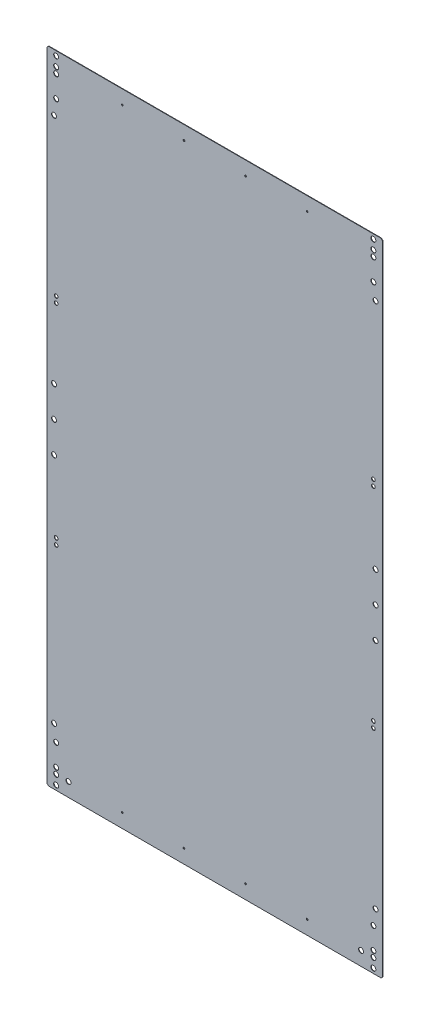
from build123d import *

# Parameters (mm, degrees)
SKETCH_1_W             = 1090
SKETCH_1_H             = 2080
SM_BASE_FLANGE_1_DEPTH = 1.5
SKETCH_6_R             = 8
CUT_EXTRUDE_1_DEPTH    = 10
SKETCH_7_R             = 8
CUT_EXTRUDE_2_DEPTH    = 10
OTHER_START            = -1.5
OTHER_1_DEPTH          = 1.5
SKETCH_11_R            = 6
CUT_EXTRUDE_6_DEPTH    = 10
SKETCH_12_R            = 2.75
CUT_EXTRUDE_7_DEPTH    = 10


# Read off the part's stored shape, not the designer's step: Затупленный угол1
# Sheet-metal steps are written as plain solids
with BuildPart() as part:
    # Sketch 1 → Базовая кромка1 (new body)
    with BuildSketch(Plane.XY):
        Rectangle(SKETCH_1_W, SKETCH_1_H)
    extrude(amount=-SM_BASE_FLANGE_1_DEPTH)

    # Эскиз6 → Вырез-Вытянуть1 (cut)
    with BuildSketch(Plane.XY):
        with Locations((-515, 1025)):
            Circle(SKETCH_6_R)
        with Locations((-515, 995)):
            Circle(SKETCH_6_R)
        with Locations((-515, 975)):
            Circle(SKETCH_6_R)
        with Locations((-515, 905)):
            Circle(SKETCH_6_R)
        with Locations((-522, 855)):
            Circle(SKETCH_6_R)
        with Locations((-522, 0)):
            Circle(SKETCH_6_R)
        with Locations((-522, 100)):
            Circle(SKETCH_6_R)
        with Locations((-522, -100)):
            Circle(SKETCH_6_R)
        with Locations(Location((-522, -855, 0), (0, 0, 180))):
            Circle(SKETCH_6_R)
        with Locations(Location((-515, -905, 0), (0, 0, 180))):
            Circle(SKETCH_6_R)
        with Locations(Location((-515, -975, 0), (0, 0, 180))):
            Circle(SKETCH_6_R)
        with Locations(Location((-515, -995, 0), (0, 0, 180))):
            Circle(SKETCH_6_R)
        with Locations(Location((-515, -1025, 0), (0, 0, 180))):
            Circle(SKETCH_6_R)
        with Locations((515, -1025)):
            Circle(SKETCH_6_R)
        with Locations((515, -995)):
            Circle(SKETCH_6_R)
        with Locations((515, -975)):
            Circle(SKETCH_6_R)
        with Locations((515, -905)):
            Circle(SKETCH_6_R)
        with Locations((522, -855)):
            Circle(SKETCH_6_R)
        with Locations(Location((522, -100, 0), (0, 0, 180))):
            Circle(SKETCH_6_R)
        with Locations(Location((522, 100, 0), (0, 0, 180))):
            Circle(SKETCH_6_R)
        with Locations(Location((522, 0, 0), (0, 0, 180))):
            Circle(SKETCH_6_R)
        with Locations(Location((522, 855, 0), (0, 0, 180))):
            Circle(SKETCH_6_R)
        with Locations(Location((515, 905, 0), (0, 0, 180))):
            Circle(SKETCH_6_R)
        with Locations(Location((515, 975, 0), (0, 0, 180))):
            Circle(SKETCH_6_R)
        with Locations(Location((515, 995, 0), (0, 0, 180))):
            Circle(SKETCH_6_R)
        with Locations(Location((515, 1025, 0), (0, 0, 180))):
            Circle(SKETCH_6_R)
    extrude(amount=-CUT_EXTRUDE_1_DEPTH, mode=Mode.SUBTRACT)

    # Эскиз7 → Вырез-Вытянуть2 (cut)
    with BuildSketch(Plane.XY):
        with Locations((-475, -995)):
            Circle(SKETCH_7_R)
        with Locations((475, -995)):
            Circle(SKETCH_7_R)
    extrude(amount=-CUT_EXTRUDE_2_DEPTH, mode=Mode.SUBTRACT)

    # Other 1 outline → Other 1 (cut)
    with BuildSketch(Plane.XY.offset(OTHER_START)):
        Polygon((-545, -1040), (-540, -1040), (-545, -1035), align=None)
        Polygon((545, -1035), (540, -1040), (545, -1040), align=None)
        Polygon((-545, 1040), (-545, 1035), (-540, 1040), align=None)
        Polygon((540, 1040), (545, 1035), (545, 1040), align=None)
    extrude(amount=OTHER_1_DEPTH, mode=Mode.SUBTRACT)

    # Эскиз11 → Вырез-Вытянуть6 (cut)
    with BuildSketch(Plane(origin=(0, 0, -1.5), x_dir=(-1, 0, 0), z_dir=(0, 0, -1))):
        with Locations((-515, -330)):
            Circle(SKETCH_11_R)
        with Locations((-515, -350)):
            Circle(SKETCH_11_R)
        with Locations(Location((515, -350, 0), (0, 0, 180))):
            Circle(SKETCH_11_R)
        with Locations(Location((515, -330, 0), (0, 0, 180))):
            Circle(SKETCH_11_R)
        with Locations((515, 330)):
            Circle(SKETCH_11_R)
        with Locations((515, 350)):
            Circle(SKETCH_11_R)
        with Locations(Location((-515, 350, 0), (0, 0, 180))):
            Circle(SKETCH_11_R)
        with Locations(Location((-515, 330, 0), (0, 0, 180))):
            Circle(SKETCH_11_R)
    extrude(amount=-CUT_EXTRUDE_6_DEPTH, mode=Mode.SUBTRACT)

    # Эскиз12 → Вырез-Вытянуть7 (cut)
    with BuildSketch(Plane.XY):
        with Locations((-300, -995)):
            Circle(SKETCH_12_R)
        with Locations((-100, 995)):
            Circle(SKETCH_12_R)
        with Locations((300, -995)):
            Circle(SKETCH_12_R)
        with Locations((-100, -995)):
            Circle(SKETCH_12_R)
        with Locations((100, -995)):
            Circle(SKETCH_12_R)
        with Locations((-300, 995)):
            Circle(SKETCH_12_R)
        with Locations((100, 995)):
            Circle(SKETCH_12_R)
        with Locations((300, 995)):
            Circle(SKETCH_12_R)
    extrude(amount=-CUT_EXTRUDE_7_DEPTH, mode=Mode.SUBTRACT)


solid = part.part
